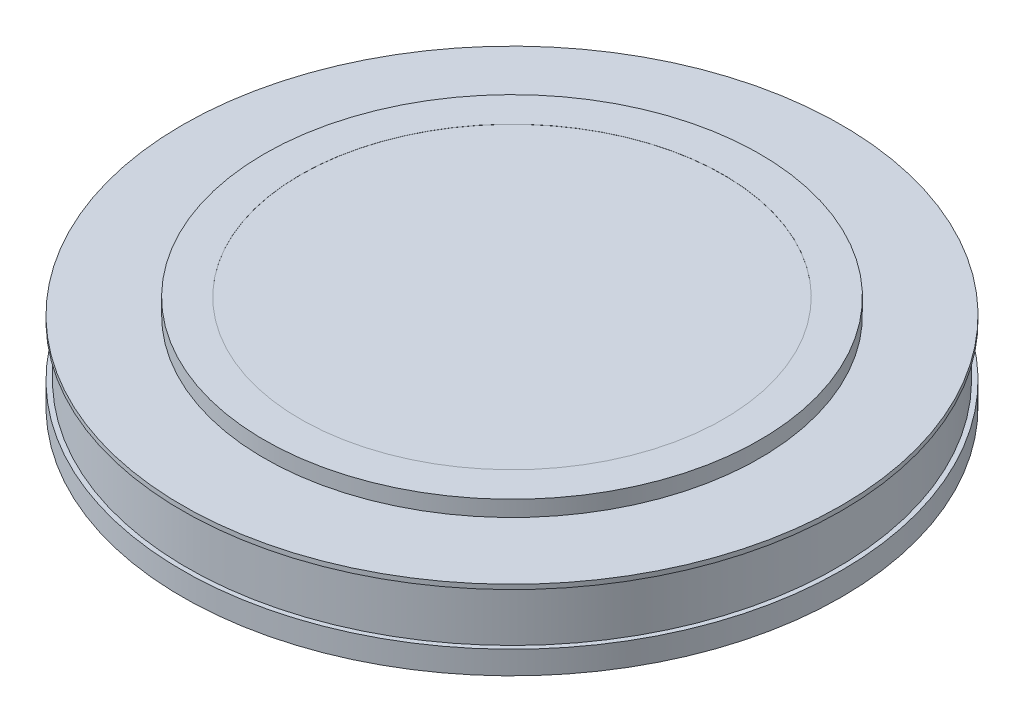
from build123d import *


with BuildPart() as part:
    # Croquis2 → Revolución1 (revolve)
    with BuildSketch(Plane.XY):
        Polygon((125.9, 0), (142.9, 0), (142.9, 10), (140.9, 10), (140.9, 32.4), (142.9, 32.4), (142.9, 34.4), (107.45, 34.4), (107.45, 41.25), (91.761475131, 41.25), (91.761475131, 41.197884914), (0, 41.197884914), (0, 38.197884914), (104.45, 38.197884914), (104.45, 31.4), (125.9, 31.4), align=None)
    revolve(axis=Axis((0, 41.197884914, 0), (0, -1, 0)))


solid = part.part
